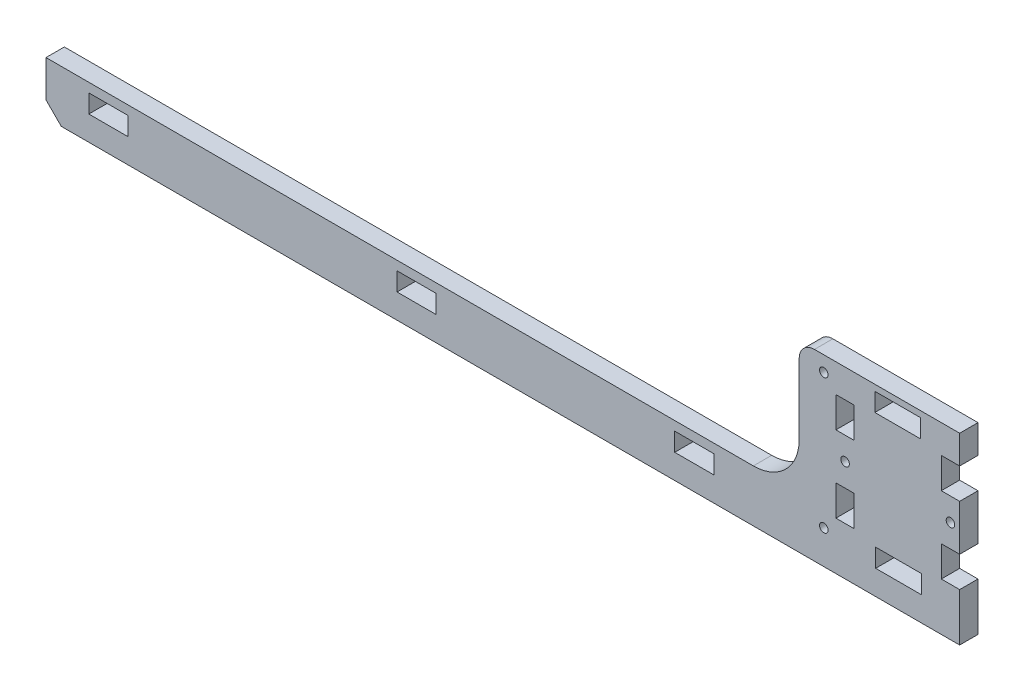
from build123d import *

# Parameters (mm, degrees)
SKETCH_1_R      = 1.4
SKETCH_1_W      = 12.8
SKETCH_1_H      = 6
SKETCH_1_W_2    = 15
SKETCH_1_W_3    = 6
SKETCH_1_H_2    = 10
EXTRUDE_1_DEPTH = 6


with BuildPart() as part:
    # Эскиз1 → Бобышка-Вытянуть1 (new body)
    with BuildSketch(Plane.XY):
        with BuildLine():
            Line((96.920798757, 2), (96.920798757, 25))
            ThreePointArc((96.920798757, 25), (98.385264851, 28.535533906), (101.920798757, 30))
            Line((101.920798757, 30), (149.389201243, 30))
            Line((149.389201243, 30), (149.389201243, 20.709265489))
            Line((149.389201243, 20.709265489), (143.389201243, 20.709265489))
            Line((143.389201243, 20.709265489), (143.389201243, 10.709265489))
            Line((143.389201243, 10.709265489), (149.389201243, 10.709265489))
            Line((149.389201243, 10.709265489), (149.389201243, -4.290734511))
            Line((149.389201243, -4.290734511), (143.389201243, -4.290734511))
            Line((143.389201243, -4.290734511), (143.389201243, -14.290734511))
            Line((143.389201243, -14.290734511), (149.389201243, -14.290734511))
            Line((149.389201243, -14.290734511), (149.389201243, -30))
            Line((149.389201243, -30), (-144.389201243, -30))
            Line((-144.389201243, -30), (-149.389201243, -25))
            Line((-149.389201243, -25), (-149.389201243, -13))
            Line((-149.389201243, -13), (81.920798757, -13))
            ThreePointArc((81.920798757, -13), (92.527400475, -8.606601718), (96.920798757, 2))
        make_face()
        with Locations((104.970798757, -19)):
            Circle(SKETCH_1_R, mode=Mode.SUBTRACT)
        with Locations((104.970798757, 25)):
            Circle(SKETCH_1_R, mode=Mode.SUBTRACT)
        with Locations((111.920798757, 3.209265489)):
            Circle(SKETCH_1_R, mode=Mode.SUBTRACT)
        with Locations((146.389201243, 3.209265489)):
            Circle(SKETCH_1_R, mode=Mode.SUBTRACT)
        with Locations((-128.98858016, -19)):
            Rectangle(SKETCH_1_W, SKETCH_1_H, mode=Mode.SUBTRACT)
        with Locations((-28.18858016, -19)):
            Rectangle(SKETCH_1_W, SKETCH_1_H, mode=Mode.SUBTRACT)
        with Locations((62.61141984, -19)):
            Rectangle(SKETCH_1_W, SKETCH_1_H, mode=Mode.SUBTRACT)
        with Locations((129.420798757, -19)):
            Rectangle(SKETCH_1_W_2, SKETCH_1_H, mode=Mode.SUBTRACT)
        with Locations((111.920798757, 15.709265489)):
            Rectangle(SKETCH_1_W_3, SKETCH_1_H_2, mode=Mode.SUBTRACT)
        with Locations((111.920798757, -9.290734511)):
            Rectangle(SKETCH_1_W_3, SKETCH_1_H_2, mode=Mode.SUBTRACT)
        with Locations((129.155798757, 25)):
            Rectangle(SKETCH_1_W_2, SKETCH_1_H, mode=Mode.SUBTRACT)
    extrude(amount=EXTRUDE_1_DEPTH)


solid = part.part
